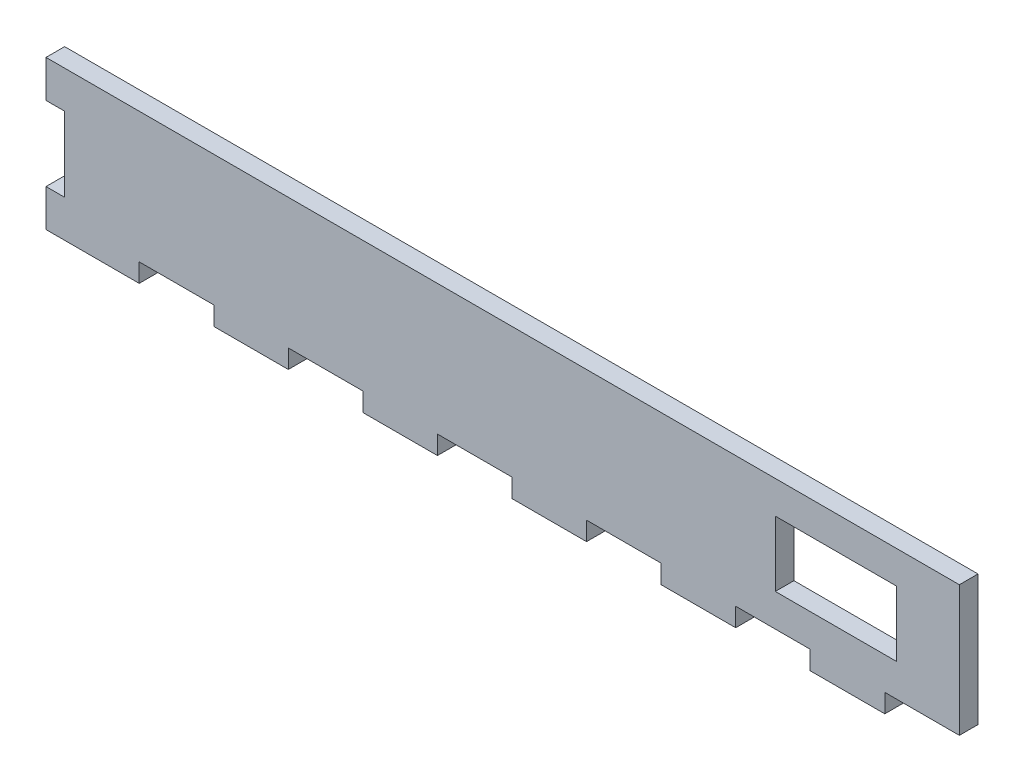
from build123d import *

# Parameters (mm, degrees)
SKETCH1_W           = 304.8
SKETCH1_H           = 44.45
BOSS_EXTRUDE1_DEPTH = 6.35
SKETCH2_W           = 41.275
SKETCH2_H           = 22.225
CUT_EXTRUDE1_DEPTH  = 264.747800776
SKETCH5_W           = 25.4
SKETCH5_H           = 6.35
BOSS_EXTRUDE2_DEPTH = 6.35
LPATTERN1_COUNT     = 6
LPATTERN1_PITCH     = 50.8
SKETCH6_W           = 6.35
SKETCH6_H           = 12.7
BOSS_EXTRUDE3_DEPTH = 6.35
LPATTERN2_COUNT     = 2
LPATTERN2_PITCH     = 38.1


with BuildPart() as part:
    # Sketch1 → Boss-Extrude1 (new body)
    with BuildSketch(Plane.XY):
        with Locations((-110.333, 0)):
            Rectangle(SKETCH1_W, SKETCH1_H)
    extrude(amount=BOSS_EXTRUDE1_DEPTH)

    # Sketch2 → Cut-Extrude1 (cut, through all)
    with BuildSketch(Plane.XY.offset(6.35)):
        Rectangle(SKETCH2_W, SKETCH2_H)
    extrude(amount=-CUT_EXTRUDE1_DEPTH, mode=Mode.SUBTRACT)

    # Sketch5 → Boss-Extrude2 (add)
    with BuildSketch(Plane.XZ.offset(22.225)):
        with Locations((3.967, 3.175)):
            Rectangle(SKETCH5_W, SKETCH5_H)
    boss_extrude2 = extrude(amount=BOSS_EXTRUDE2_DEPTH)

    # LPattern1: Boss-Extrude2 ×6
    with Locations(*[(-i * LPATTERN1_PITCH, 0, 0) for i in range(1, LPATTERN1_COUNT)]):
        add(boss_extrude2)

    # Sketch6 → Boss-Extrude3 (add)
    with BuildSketch(Plane.ZY.offset(262.733)):
        with Locations((3.175, 15.875)):
            Rectangle(SKETCH6_W, SKETCH6_H)
    boss_extrude3 = extrude(amount=BOSS_EXTRUDE3_DEPTH)

    # LPattern2: Boss-Extrude3 ×2
    with Locations(*[(0, -i * LPATTERN2_PITCH, 0) for i in range(1, LPATTERN2_COUNT)]):
        add(boss_extrude3)


solid = part.part
